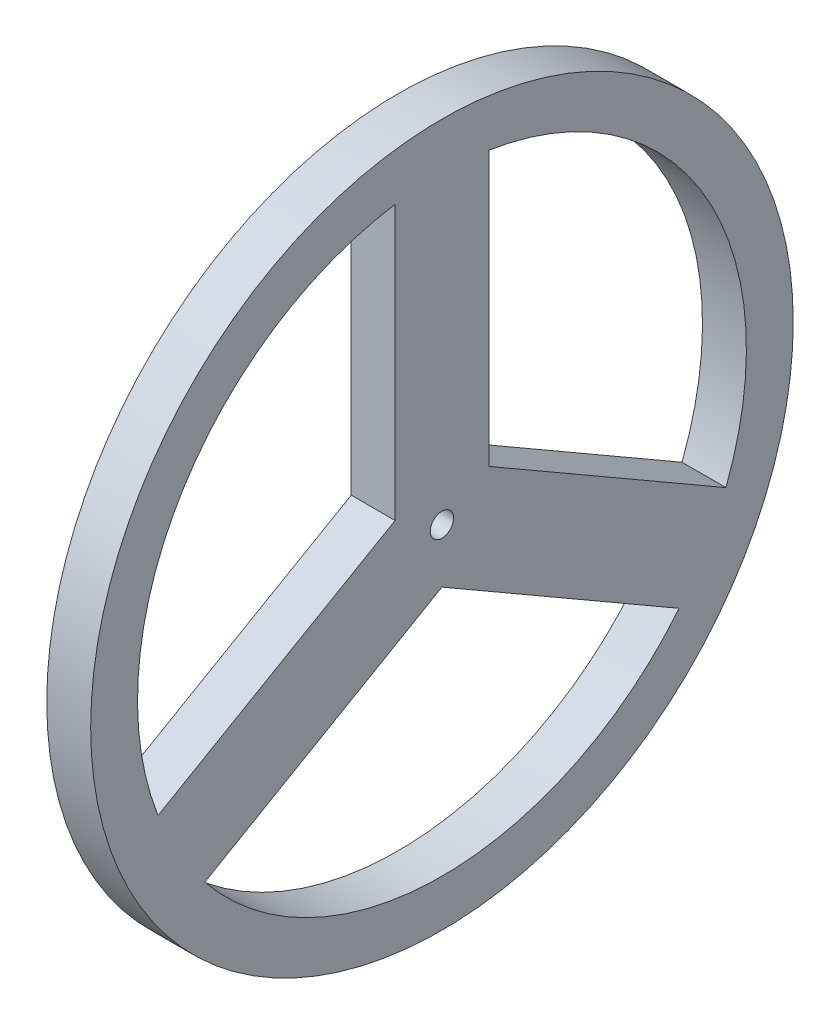
from build123d import *

# Parameters (mm, degrees)
SKETCH2_R           = 38.1
BOSS_EXTRUDE5_DEPTH = 4.7625
SKETCH2_3_R         = 1.27
CUT_EXTRUDE3_DEPTH  = 55.091601994


with BuildPart() as part:
    # Sketch2 → Boss-Extrude5 (new body)
    with BuildSketch(Plane(origin=(0, 0, 0), x_dir=(0, 0, -1), z_dir=(1, 0, 0))):
        Circle(SKETCH2_R)
    extrude(amount=BOSS_EXTRUDE5_DEPTH)

    # Sketch2<3> → Cut-Extrude3 (cut, through all)
    with BuildSketch(Plane(origin=(0, 0, 0), x_dir=(0, 0, -1), z_dir=(1, 0, 0))):
        with BuildLine():
            Line((25.715716236, -20.712854426), (0, -5.865878735))
            Line((0, -5.865878735), (-25.715716236, -20.712854426))
            ThreePointArc((-25.715716236, -20.712854426), (0, -33.02), (25.715716236, -20.712854426))
        make_face()
        with BuildLine():
            Line((-30.795716236, -11.914036324), (-5.08, 2.932939367))
            Line((-5.08, 2.932939367), (-5.08, 32.62689075))
            ThreePointArc((-5.08, 32.62689075), (-28.596158833, 16.51), (-30.795716236, -11.914036324))
        make_face()
        with BuildLine():
            Line((5.08, 2.932939367), (30.795716236, -11.914036324))
            ThreePointArc((30.795716236, -11.914036324), (28.596158833, 16.51), (5.08, 32.62689075))
            Line((5.08, 32.62689075), (5.08, 2.932939367))
        make_face()
        Circle(SKETCH2_3_R)
    extrude(amount=CUT_EXTRUDE3_DEPTH, mode=Mode.SUBTRACT)


solid = part.part
